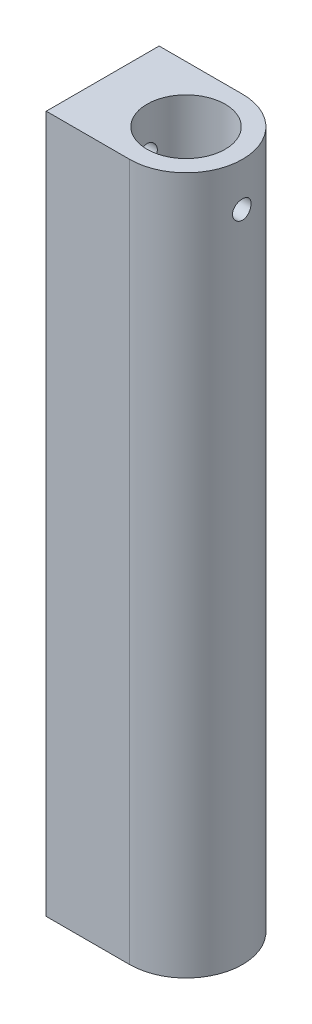
from build123d import *

# Parameters (mm, degrees)
SKETCH1_R             = 5.715
BOSS_EXTRUDE1_DEPTH   = 101.981
SKETCH4_R             = 5.715
SKETCH4_R_2           = 5.08
BOSS_EXTRUDE2_DEPTH   = 3.81
F_6_32_TAPPED_HOLE1_D = 2.7051


with BuildPart() as part:
    # Sketch1 → Boss-Extrude1 (new body)
    with BuildSketch(Plane(origin=(0, 0, 0), x_dir=(1, 0, 0), z_dir=(0, 1, 0))):
        with BuildLine():
            Line((0, 8.255), (-12.192, 8.255))
            Line((-12.192, 8.255), (-12.192, -8.255))
            Line((-12.192, -8.255), (0, -8.255))
            ThreePointArc((0, -8.255), (8.255, 0), (0, 8.255))
        make_face()
        Circle(SKETCH1_R, mode=Mode.SUBTRACT)
    extrude(amount=BOSS_EXTRUDE1_DEPTH)

    # Sketch4 → Boss-Extrude2 (add)
    with BuildSketch(Plane.XZ):
        Circle(SKETCH4_R)
        Circle(SKETCH4_R_2, mode=Mode.SUBTRACT)
    extrude(amount=-BOSS_EXTRUDE2_DEPTH)

    # #6-32 Tapped Hole1 (through all)
    with Locations(Plane.ZY.offset(12.192)):
        with Locations((0, 95.631)):
            Hole(F_6_32_TAPPED_HOLE1_D / 2)


solid = part.part
